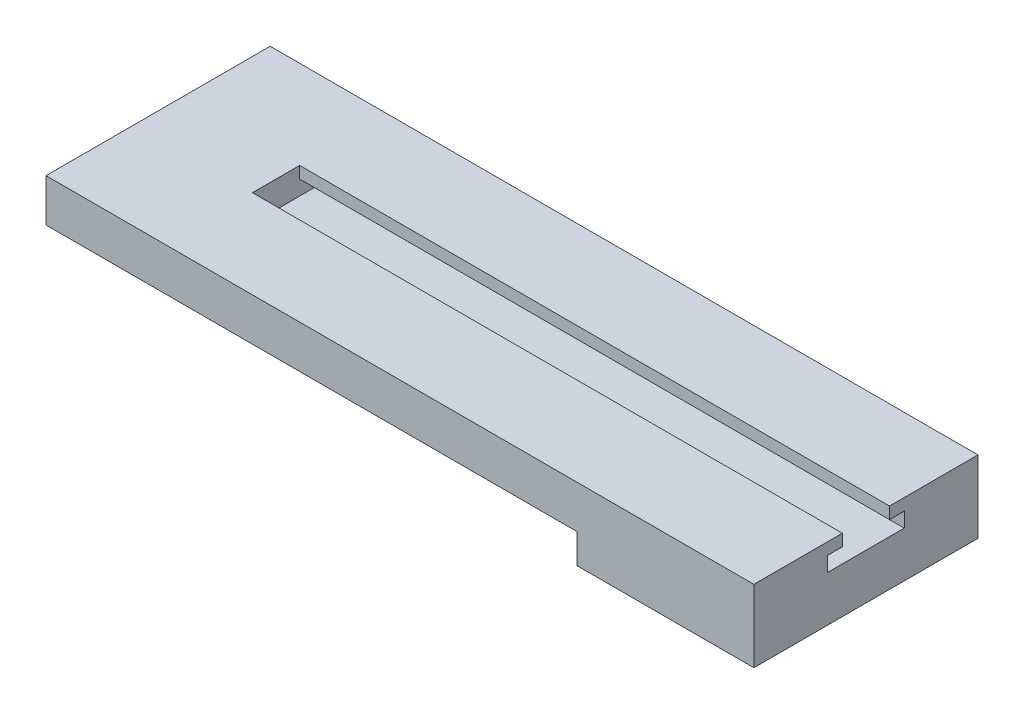
from build123d import *

# Parameters (mm, degrees)
BOSS_EXTRUDE1_DEPTH = 4
BOSS_EXTRUDE2_DEPTH = 5
BOSS_EXTRUDE3_START = -5
SKETCH3_W           = 240
SKETCH3_H           = 76
BOSS_EXTRUDE3_DEPTH = 5.5
BOSS_EXTRUDE4_START = -10.5
SKETCH4_W           = 60
SKETCH4_H           = 76
BOSS_EXTRUDE4_DEPTH = 10
CUT_EXTRUDE1_START  = -20.5
SKETCH5_R           = 10.5
CUT_EXTRUDE1_DEPTH  = 4


with BuildPart() as part:
    # Sketch1 → Boss-Extrude1 (new body)
    with BuildSketch(Plane(origin=(0, 0, 0), x_dir=(1, 0, 0), z_dir=(0, 1, 0))):
        Polygon((0, 0), (200, 0), (200, 30), (-40, 30), (-40, -46), (200, -46), (200, -16), (0, -16), align=None)
    extrude(amount=BOSS_EXTRUDE1_DEPTH)

    # Sketch2 → Boss-Extrude2 (add)
    with BuildSketch(Plane(origin=(0, 0, 0), x_dir=(1, 0, 0), z_dir=(0, 1, 0))):
        Polygon((200, 5), (0, 5), (0, -21), (200, -21), (200, -46), (-40, -46), (-40, 30), (200, 30), align=None)
    extrude(amount=-BOSS_EXTRUDE2_DEPTH)

    # Sketch3 → Boss-Extrude3 (add)
    with BuildSketch(Plane(origin=(0, 0, 0), x_dir=(1, 0, 0), z_dir=(0, 1, 0)).offset(BOSS_EXTRUDE3_START)):
        with Locations((80, -8)):
            Rectangle(SKETCH3_W, SKETCH3_H)
    extrude(amount=-BOSS_EXTRUDE3_DEPTH)

    # Sketch4 → Boss-Extrude4 (add)
    with BuildSketch(Plane(origin=(0, 0, 0), x_dir=(1, 0, 0), z_dir=(0, 1, 0)).offset(BOSS_EXTRUDE4_START)):
        with Locations((170, -8)):
            Rectangle(SKETCH4_W, SKETCH4_H)
    extrude(amount=-BOSS_EXTRUDE4_DEPTH)

    # Sketch5 → Cut-Extrude1 (cut)
    with BuildSketch(Plane(origin=(0, 0, 0), x_dir=(1, 0, 0), z_dir=(0, 1, 0)).offset(CUT_EXTRUDE1_START)):
        with Locations((170, -8)):
            Circle(SKETCH5_R)
    extrude(amount=CUT_EXTRUDE1_DEPTH, mode=Mode.SUBTRACT)


solid = part.part
